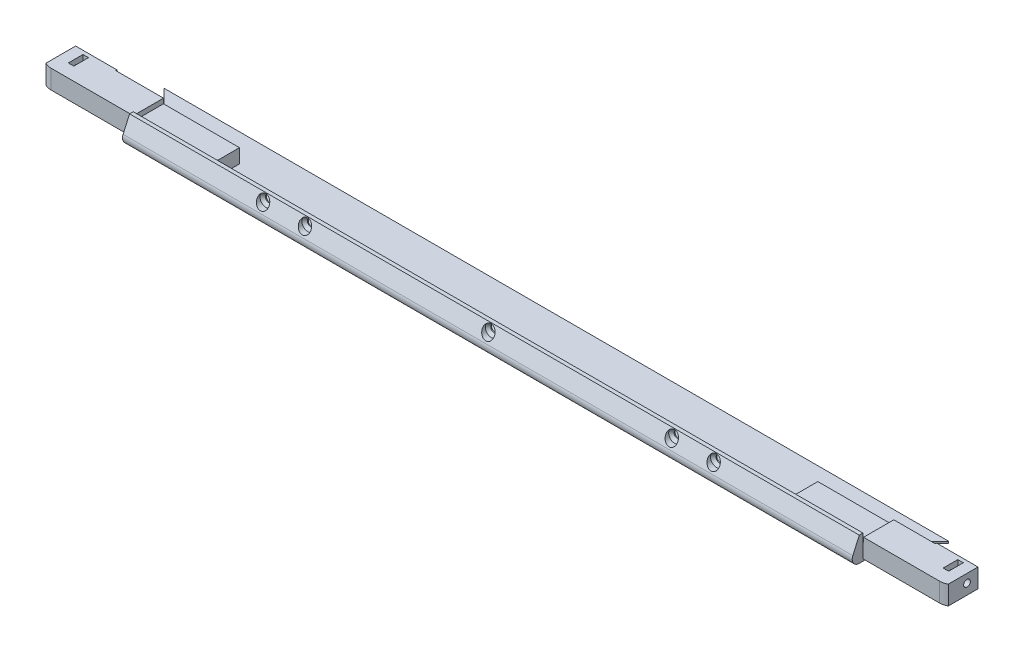
from build123d import *

# Parameters (mm, degrees)
BOSS_EXTRUDE1_DEPTH = 8
BOSS_EXTRUDE2_DEPTH = 0.6
CUT_EXTRUDE1_DEPTH  = 0.6
SKETCH4_R           = 1.1
CUT_EXTRUDE2_DEPTH  = 13.5
CUT_EXTRUDE3_START  = -13.5
SKETCH5_R           = 1.1
CUT_EXTRUDE3_DEPTH  = 13.5
CUT_EXTRUDE6_START  = -3.6
CUT_EXTRUDE6_DEPTH  = 1.8
CUT_EXTRUDE7_START  = -3.6
CUT_EXTRUDE7_DEPTH  = 1.8
SKETCH8_W           = 295.2
SKETCH8_H           = 19.1
CUT_EXTRUDE8_DEPTH  = 1.2
SKETCH9_W           = 24.86
SKETCH9_H           = 10
CUT_EXTRUDE9_DEPTH  = 1.6
BOSS_EXTRUDE3_DEPTH = 238.72
SKETCH11_R          = 1.1
CUT_EXTRUDE10_DEPTH = 1.2
CUT_EXTRUDE11_REACH = 151.204
SKETCH12_R          = 2
CHAMFER1_SIZE       = 0.9


with BuildPart() as part:
    # Sketch1 → Boss-Extrude1 (new body)
    with BuildSketch(Plane(origin=(0, 0, 0), x_dir=(1, 0, 0), z_dir=(0, 1, 0))):
        with BuildLine():
            Line((-118.36, 0), (120.36, 0))
            Line((120.36, 0), (120.36, 1.3))
            Line((120.36, 1.3), (145.3, 1.3))
            ThreePointArc((145.3, 1.3), (146.488640518, 1.452788358), (147.6, 1.901219694))
            Line((147.6, 1.901219694), (147.6, 11.6))
            Line((147.6, 11.6), (134.1, 11.6))
            Line((134.1, 11.6), (134.1, 11.2))
            Line((134.1, 11.2), (95.6, 11.2))
            Line((95.6, 11.2), (95.6, 1.2))
            Line((95.6, 1.2), (-93.6, 1.2))
            Line((-93.6, 1.2), (-93.6, 11.2))
            Line((-93.6, 11.2), (-134.1, 11.2))
            Line((-134.1, 11.2), (-134.1, 11.6))
            Line((-134.1, 11.6), (-147.6, 11.6))
            Line((-147.6, 11.6), (-147.6, 1.901219694))
            ThreePointArc((-147.6, 1.901219694), (-146.488640518, 1.452788358), (-145.3, 1.3))
            Line((-145.3, 1.3), (-118.36, 1.3))
            Line((-118.36, 1.3), (-118.36, 0))
        make_face()
    extrude(amount=BOSS_EXTRUDE1_DEPTH)

    # Sketch2 → Boss-Extrude2 (add)
    with BuildSketch(Plane.XZ):
        Polygon((120.36, -1.2), (120.36, -11.341421356), (129.318578644, -20.3), (-127.318578644, -20.3), (-118.36, -11.341421356), (-118.36, -1.2), align=None)
    extrude(amount=-BOSS_EXTRUDE2_DEPTH)

    # Sketch3 → Cut-Extrude1 (cut)
    with BuildSketch(Plane.XZ):
        Polygon((-118.36, -11.2), (-134.1, -11.2), (-134.1, -11.6), (-147.6, -11.6), (-147.6, -1.3), (-118.36, -1.3), align=None)
        Polygon((120.36, -1.3), (147.6, -1.3), (147.6, -11.6), (134.1, -11.6), (134.1, -11.2), (120.36, -11.2), align=None)
    extrude(amount=-CUT_EXTRUDE1_DEPTH, mode=Mode.SUBTRACT)

    # Sketch4 → Cut-Extrude2 (cut)
    with BuildSketch(Plane(origin=(147.6, 0, 0), x_dir=(0, 0, -1), z_dir=(1, 0, 0))):
        with Locations((8, 4)):
            Circle(SKETCH4_R)
    extrude(amount=-CUT_EXTRUDE2_DEPTH, mode=Mode.SUBTRACT)

    # Sketch5 → Cut-Extrude3 (cut)
    with BuildSketch(Plane.ZY.offset(147.6).offset(CUT_EXTRUDE3_START)):
        with Locations(Location((-8, 4, 0), (0, 0, 180))):
            Circle(SKETCH5_R)
    extrude(amount=CUT_EXTRUDE3_DEPTH, mode=Mode.SUBTRACT)

    # Sketch6 → Cut-Extrude6 (cut)
    with BuildSketch(Plane(origin=(147.6, 0, 0), x_dir=(0, 0, -1), z_dir=(1, 0, 0)).offset(CUT_EXTRUDE6_START)):
        Polygon((5.6, 5.385640646), (5.6, 2.614359354), (8, 1.228718708), (10.4, 2.614359354), (10.4, 5.385640646), (10.4, 8), (5.6, 8), align=None)
    extrude(amount=-CUT_EXTRUDE6_DEPTH, mode=Mode.SUBTRACT)

    # Sketch7 → Cut-Extrude7 (cut)
    with BuildSketch(Plane.ZY.offset(147.6).offset(CUT_EXTRUDE7_START)):
        Polygon((-10.4, 8), (-10.4, 2.614359354), (-8, 1.228718708), (-5.6, 2.614359354), (-5.6, 8), align=None)
    extrude(amount=-CUT_EXTRUDE7_DEPTH, mode=Mode.SUBTRACT)

    # Sketch8 → Cut-Extrude8 (cut)
    with BuildSketch(Plane(origin=(0, 8, 0), x_dir=(1, 0, 0), z_dir=(0, 1, 0))):
        with Locations((0, 10.75)):
            Rectangle(SKETCH8_W, SKETCH8_H)
    extrude(amount=-CUT_EXTRUDE8_DEPTH, mode=Mode.SUBTRACT)

    # Sketch9 → Cut-Extrude9 (cut)
    with BuildSketch(Plane(origin=(0, 6.8, 0), x_dir=(1, 0, 0), z_dir=(0, 1, 0))):
        with Locations((108.03, 6.2)):
            Rectangle(SKETCH9_W, SKETCH9_H)
        with Locations((-106.03, 6.2)):
            Rectangle(SKETCH9_W, SKETCH9_H)
    extrude(amount=-CUT_EXTRUDE9_DEPTH, mode=Mode.SUBTRACT)

    # Sketch10 → Boss-Extrude3 (add)
    with BuildSketch(Plane.ZY.offset(118.36)):
        with BuildLine():
            Line((0, 8), (2.113102916, 3.253893145))
            ThreePointArc((2.113102916, 3.253893145), (1.939911372, 1.053285936), (0, 0))
            Line((0, 0), (0, 8))
        make_face()
    extrude(amount=-BOSS_EXTRUDE3_DEPTH)

    # Sketch11 → Cut-Extrude10 (cut)
    with BuildSketch(Plane(origin=(0, 0, -1.2), x_dir=(-1, 0, 0), z_dir=(0, 0, -1))):
        with Locations((73.7, 5.8)):
            Circle(SKETCH11_R)
        with Locations((-73.7, 5.8)):
            Circle(SKETCH11_R)
        with Locations((60, 5.8)):
            Circle(SKETCH11_R)
        with Locations((0, 5.8)):
            Circle(SKETCH11_R)
        with Locations((-60, 5.8)):
            Circle(SKETCH11_R)
    extrude(amount=-CUT_EXTRUDE10_DEPTH, mode=Mode.SUBTRACT)

    # Sketch12 → Cut-Extrude11 (cut, up to next)
    with BuildSketch(Plane(origin=(0, 0, 0), x_dir=(-1, 0, 0), z_dir=(0, 0, -1)), mode=Mode.PRIVATE) as cut_extrude11_sk1:
        with Locations((-73.7, 5.8)):
            Circle(SKETCH12_R)
    cut_extrude11_tool1 = extrude(cut_extrude11_sk1.sketch, amount=-CUT_EXTRUDE11_REACH, mode=Mode.PRIVATE) & part.part
    # Sketch12 → Cut-Extrude11 (cut, up to next)
    with BuildSketch(Plane(origin=(0, 0, 0), x_dir=(-1, 0, 0), z_dir=(0, 0, -1)), mode=Mode.PRIVATE) as cut_extrude11_sk2:
        with Locations((73.7, 5.8)):
            Circle(SKETCH12_R)
    cut_extrude11_tool2 = extrude(cut_extrude11_sk2.sketch, amount=-CUT_EXTRUDE11_REACH, mode=Mode.PRIVATE) & part.part
    # Sketch12 → Cut-Extrude11 (cut, up to next)
    with BuildSketch(Plane(origin=(0, 0, 0), x_dir=(-1, 0, 0), z_dir=(0, 0, -1)), mode=Mode.PRIVATE) as cut_extrude11_sk3:
        with Locations((-60, 5.8)):
            Circle(SKETCH12_R)
    cut_extrude11_tool3 = extrude(cut_extrude11_sk3.sketch, amount=-CUT_EXTRUDE11_REACH, mode=Mode.PRIVATE) & part.part
    # Sketch12 → Cut-Extrude11 (cut, up to next)
    with BuildSketch(Plane(origin=(0, 0, 0), x_dir=(-1, 0, 0), z_dir=(0, 0, -1)), mode=Mode.PRIVATE) as cut_extrude11_sk4:
        with Locations((0, 5.8)):
            Circle(SKETCH12_R)
    cut_extrude11_tool4 = extrude(cut_extrude11_sk4.sketch, amount=-CUT_EXTRUDE11_REACH, mode=Mode.PRIVATE) & part.part
    # Sketch12 → Cut-Extrude11 (cut, up to next)
    with BuildSketch(Plane(origin=(0, 0, 0), x_dir=(-1, 0, 0), z_dir=(0, 0, -1)), mode=Mode.PRIVATE) as cut_extrude11_sk5:
        with Locations((60, 5.8)):
            Circle(SKETCH12_R)
    cut_extrude11_tool5 = extrude(cut_extrude11_sk5.sketch, amount=-CUT_EXTRUDE11_REACH, mode=Mode.PRIVATE) & part.part
    add(cut_extrude11_tool1.solids().sort_by_distance((73.7, 5.8, 0))[0], mode=Mode.SUBTRACT)
    add(cut_extrude11_tool2.solids().sort_by_distance((-73.7, 5.8, 0))[0], mode=Mode.SUBTRACT)
    add(cut_extrude11_tool3.solids().sort_by_distance((60, 5.8, 0))[0], mode=Mode.SUBTRACT)
    add(cut_extrude11_tool4.solids().sort_by_distance((0, 5.8, 0))[0], mode=Mode.SUBTRACT)
    add(cut_extrude11_tool5.solids().sort_by_distance((-60, 5.8, 0))[0], mode=Mode.SUBTRACT)

    # Chamfer1
    chamfer1_edges = [part.edges().sort_by_distance(p)[0] for p in [
        (74.8, 5.8, 0),
        (-58.9, 5.8, 0),
        (1.1, 5.8, 0),
        (61.1, 5.8, 0),
        (-72.6, 5.8, 0),
    ]]
    chamfer(chamfer1_edges, length=CHAMFER1_SIZE - 0.0001)  # a hair under: the kernel refuses the full size


solid = part.part
